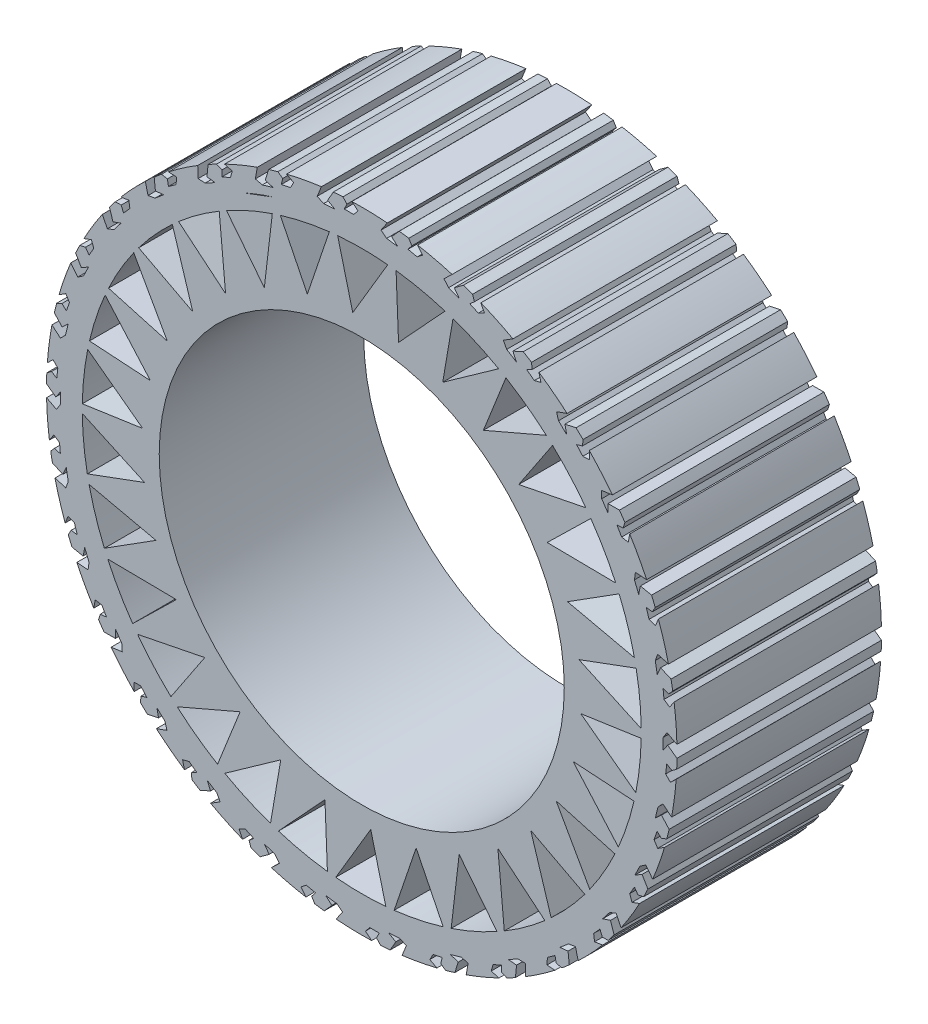
from build123d import *

# Parameters (mm, degrees)
SKETCH1_R           = 203
BOSS_EXTRUDE5_DEPTH = 205


with BuildPart() as part:
    # Sketch1 → Boss-Extrude5 (new body)
    with BuildSketch(Plane.XY):
        with BuildLine():
            Line((151.513191313, 266.644594898), (154.948122137, 259.055511918))
            Line((154.948122137, 259.055511918), (145.289916223, 265.060588741))
            Line((145.289916223, 265.060588741), (141.948192606, 271.35840521))
            Line((141.948192606, 271.35840521), (151.513191313, 277.308046868))
            ThreePointArc((151.513191313, 277.308046868), (135.683063434, 285.387642159), (119.423731597, 292.564475512))
            Line((119.423731597, 292.564475512), (122.970226981, 285.356586014))
            Line((122.970226981, 285.356586014), (116.850937177, 282.345713961))
            Line((116.850937177, 282.345713961), (108.289531928, 286.226520606))
            Line((108.289531928, 286.226520606), (112.97508405, 290.235634194))
            Line((112.97508405, 290.235634194), (111.08599614, 295.83086631))
            ThreePointArc((111.08599614, 295.83086631), (106.540858754, 297.497975482), (101.970714815, 299.095257936))
            Line((101.970714815, 299.095257936), (92.76373599, 292.319134535))
            Line((92.76373599, 292.319134535), (97.701464408, 285.610053502))
            Line((97.701464408, 285.610053502), (87.00578779, 289.475851067))
            Line((87.00578779, 289.475851067), (82.427699181, 294.941261729))
            Line((82.427699181, 294.941261729), (90.546679661, 302.749564496))
            ThreePointArc((90.546679661, 302.749564496), (73.382635738, 307.361332591), (55.986461755, 311.000829742))
            Line((55.986461755, 311.000829742), (60.954062199, 304.687807775))
            Line((60.954062199, 304.687807775), (55.594489058, 300.470458611))
            Line((55.594489058, 300.470458611), (46.413305984, 302.486444078))
            Line((46.413305984, 302.486444078), (50.162925965, 307.38212998))
            Line((50.162925965, 307.38212998), (47.151804989, 312.462329387))
            ThreePointArc((47.151804989, 312.462329387), (42.359378273, 313.148021026), (37.557009249, 313.760212672))
            Line((37.557009249, 313.760212672), (29.960060274, 305.21792529))
            Line((29.960060274, 305.21792529), (36.184783861, 299.682065239))
            Line((36.184783861, 299.682065239), (24.919088931, 301.239629642))
            Line((24.919088931, 301.239629642), (19.30471977, 305.633769824))
            Line((19.30471977, 305.633769824), (25.622843616, 314.959473401))
            ThreePointArc((25.622843616, 314.959473401), (7.875034732, 315.901857905), (-9.897685118, 315.844955365))
            Line((-9.897685118, 315.844955365), (-3.726087591, 310.702710282))
            Line((-3.726087591, 310.702710282), (-8.091705004, 305.463202402))
            Line((-8.091705004, 305.463202402), (-17.491404147, 305.526258453))
            Line((-17.491404147, 305.526258453), (-14.841592692, 311.094551702))
            Line((-14.841592692, 311.094551702), (-18.843146299, 315.43768931))
            ThreePointArc((-18.843146299, 315.43768931), (-23.673410302, 315.1119954), (-28.498117841, 314.712340526))
            Line((-28.498117841, 314.712340526), (-34.15301384, 304.777228112))
            Line((-34.15301384, 304.777228112), (-26.913345375, 300.656532691))
            Line((-26.913345375, 300.656532691), (-38.25669369, 299.837790893))
            Line((-38.25669369, 299.837790893), (-44.661968529, 302.968615585))
            Line((-44.661968529, 302.968615585), (-40.420833647, 313.404141975))
            ThreePointArc((-40.420833647, 313.404141975), (-57.976743081, 310.635956164), (-75.349255657, 306.885140846))
            Line((-75.349255657, 306.885140846), (-68.243389474, 303.138413433))
            Line((-68.243389474, 303.138413433), (-71.42425273, 297.105738473))
            Line((-71.42425273, 297.105738473), (-80.631655984, 295.213109256))
            Line((-80.631655984, 295.213109256), (-79.197462532, 301.210648717))
            Line((-79.197462532, 301.210648717), (-84.014561675, 304.626908573))
            ThreePointArc((-84.014561675, 304.626908573), (-88.671557248, 303.304063499), (-93.307740431, 301.910028942))
            Line((-93.307740431, 301.910028942), (-96.773437365, 291.016303582))
            Line((-96.773437365, 291.016303582), (-88.835232273, 288.490866954))
            Line((-88.835232273, 288.490866954), (-99.760475221, 285.331601901))
            Line((-99.760475221, 285.331601901), (-106.676714492, 287.06227904))
            Line((-106.676714492, 287.06227904), (-104.697926519, 298.151545665))
            ThreePointArc((-104.697926519, 298.151545665), (-121.294659018, 291.793772541), (-137.507702158, 284.512973074))
            Line((-137.507702158, 284.512973074), (-129.778127768, 282.325513297))
            Line((-129.778127768, 282.325513297), (-131.635217879, 275.763328101))
            Line((-131.635217879, 275.763328101), (-140.247917541, 271.997730595))
            Line((-140.247917541, 271.997730595), (-140.092023227, 278.162395015))
            Line((-140.092023227, 278.162395015), (-145.514137559, 280.502470168))
            ThreePointArc((-145.514137559, 280.502470168), (-149.79433165, 278.24028861), (-154.039367025, 275.912800367))
            Line((-154.039367025, 275.912800367), (-155.164397307, 264.536570135))
            Line((-155.164397307, 264.536570135), (-146.874593243, 263.716765998))
            Line((-146.874593243, 263.716765998), (-156.90424528, 258.355052733))
            Line((-156.90424528, 258.355052733), (-164.029176139, 258.609943423))
            Line((-164.029176139, 258.609943423), (-164.399217605, 269.86829612))
            ThreePointArc((-164.399217605, 269.86829612), (-179.311416319, 260.198800877), (-193.65640224, 249.706223133))
            Line((-193.65640224, 249.706223133), (-185.640939135, 249.173633482))
            Line((-185.640939135, 249.173633482), (-186.093092352, 242.368737032))
            Line((-186.093092352, 242.368737032), (-193.734672118, 236.894745917))
            Line((-193.734672118, 236.894745917), (-194.863890271, 242.957109879))
            Line((-194.863890271, 242.957109879), (-200.654047378, 244.118727817))
            ThreePointArc((-200.654047378, 244.118727817), (-204.370374965, 241.016077963), (-208.038734117, 237.85685844))
            Line((-208.038734117, 237.85685844), (-206.773928525, 226.495319185))
            Line((-206.773928525, 226.495319185), (-198.494829705, 227.416976915))
            Line((-198.494829705, 227.416976915), (-207.190546911, 220.087148036))
            Line((-207.190546911, 220.087148036), (-214.21277569, 218.855112331))
            Line((-214.21277569, 218.855112331), (-216.915474008, 229.790507063))
            ThreePointArc((-216.915474008, 229.790507063), (-229.491404296, 217.231893041), (-241.341388277, 203.986113019))
            Line((-241.341388277, 203.986113019), (-233.390350657, 205.131670216))
            Line((-233.390350657, 205.131670216), (-232.417805715, 198.38146914))
            Line((-232.417805715, 198.38146914), (-238.75429188, 191.438324095))
            Line((-238.75429188, 191.438324095), (-241.119270249, 197.133433204))
            Line((-241.119270249, 197.133433204), (-247.024412481, 197.065825649))
            ThreePointArc((-247.024412481, 197.065825649), (-250.014452217, 193.258308186), (-252.945810247, 189.405430436))
            Line((-252.945810247, 189.405430436), (-249.346446855, 178.555135942))
            Line((-249.346446855, 178.555135942), (-241.439889625, 181.177974673))
            Line((-241.439889625, 181.177974673), (-248.421627431, 172.200378874))
            Line((-248.421627431, 172.200378874), (-255.034249037, 169.535262646))
            Line((-255.034249037, 169.535262646), (-259.95148332, 179.669770189))
            ThreePointArc((-259.95148332, 179.669770189), (-269.641516683, 164.770909086), (-278.478597562, 149.350830932))
            Line((-278.478597562, 149.350830932), (-270.939483925, 152.124468631))
            Line((-270.939483925, 152.124468631), (-268.584745703, 145.723979107))
            Line((-268.584745703, 145.723979107), (-273.339203417, 137.615128887))
            Line((-273.339203417, 137.615128887), (-276.836581099, 142.694079547))
            Line((-276.836581099, 142.694079547), (-282.598625404, 141.400201273))
            ThreePointArc((-282.598625404, 141.400201273), (-284.731698204, 137.054222984), (-286.797940701, 132.676076253))
            Line((-286.797940701, 132.676076253), (-281.02132896, 122.811236455))
            Line((-281.02132896, 122.811236455), (-273.832867811, 127.02062555))
            Line((-273.832867811, 127.02062555), (-278.795490773, 116.787626846))
            Line((-278.795490773, 116.787626846), (-284.70950191, 112.805908463))
            Line((-284.70950191, 112.805908463), (-291.626365425, 121.696602207))
            ThreePointArc((-291.626365425, 121.696602207), (-298.007000907, 105.108645745), (-303.444955845, 88.188200868))
            Line((-303.444955845, 88.188200868), (-296.647261633, 92.468697792))
            Line((-296.647261633, 92.468697792), (-293.013243492, 86.697651926))
            Line((-293.013243492, 86.697651926), (-295.977880138, 77.777492196))
            Line((-295.977880138, 77.777492196), (-300.454804946, 82.018309891))
            Line((-300.454804946, 82.018309891), (-305.821922338, 79.554709588))
            ThreePointArc((-305.821922338, 79.554709588), (-307.004802686, 74.86021058), (-308.115624937, 70.148140888))
            Line((-308.115624937, 70.148140888), (-300.4142305, 61.699896622))
            Line((-300.4142305, 61.699896622), (-294.258035679, 67.311865577))
            Line((-294.258035679, 67.311865577), (-296.984653359, 56.270695116))
            Line((-296.984653359, 56.270695116), (-301.941583363, 51.146394778))
            Line((-301.941583363, 51.146394778), (-310.555775983, 58.404708744))
            ThreePointArc((-310.555775983, 58.404708744), (-313.348149196, 40.852630218), (-315.149313467, 23.171323252))
            Line((-315.149313467, 23.171323252), (-309.390130536, 28.771601146))
            Line((-309.390130536, 28.771601146), (-304.635656507, 23.882221334))
            Line((-304.635656507, 23.882221334), (-305.680903238, 14.540605879))
            Line((-305.680903238, 14.540605879), (-310.941712074, 17.757946526))
            Line((-310.941712074, 17.757946526), (-315.679333769, 14.232295348))
            ThreePointArc((-315.679333769, 14.232295348), (-315.860324117, 9.394447753), (-315.96717786, 4.554395157))
            Line((-315.96717786, 4.554395157), (-306.67758862, -2.108024763))
            Line((-306.67758862, -2.108024763), (-301.82271538, 4.661254081))
            Line((-301.82271538, 4.661254081), (-302.194161503, -6.705536008))
            Line((-302.194161503, -6.705536008), (-305.977368745, -12.748461787))
            Line((-305.977368745, -12.748461787), (-315.912408919, -7.439750748))
            ThreePointArc((-315.912408919, -7.439750748), (-314.994479753, -25.188841283), (-313.080133836, -42.858252378))
            Line((-313.080133836, -42.858252378), (-308.611166116, -36.182952532))
            Line((-308.611166116, -36.182952532), (-302.944029529, -39.97697693))
            Line((-302.944029529, -39.97697693), (-302.024204046, -49.331774689))
            Line((-302.024204046, -49.331774689), (-307.838974321, -47.278524315))
            Line((-307.838974321, -47.278524315), (-311.740043518, -51.712138493))
            ThreePointArc((-311.740043518, -51.712138493), (-310.911233719, -56.481897519), (-310.009448932, -61.238399496))
            Line((-310.009448932, -61.238399496), (-299.537664515, -65.82381535))
            Line((-299.537664515, -65.82381535), (-296.196294113, -58.193076587))
            Line((-296.196294113, -58.193076587), (-294.196334701, -69.388703031))
            Line((-294.196334701, -69.388703031), (-296.640474872, -76.086149398))
            Line((-296.640474872, -76.086149398), (-307.462153668, -72.959057433))
            ThreePointArc((-307.462153668, -72.959057433), (-302.874040034, -90.12943955), (-297.327850032, -107.014716723))
            Line((-297.327850032, -107.014716723), (-294.344412857, -99.556137559))
            Line((-294.344412857, -99.556137559), (-288.012294773, -102.088989471))
            Line((-288.012294773, -102.088989471), (-285.167597864, -111.048119983))
            Line((-285.167597864, -111.048119983), (-291.282196214, -110.248696776))
            Line((-291.282196214, -110.248696776), (-294.17621747, -115.396503739))
            ThreePointArc((-294.17621747, -115.396503739), (-292.37383049, -119.88971284), (-290.502819496, -124.354782237))
            Line((-290.502819496, -124.354782237), (-279.306507129, -126.662789349))
            Line((-279.306507129, -126.662789349), (-277.624673486, -118.504090565))
            Line((-277.624673486, -118.504090565), (-273.340716362, -129.039250768))
            Line((-273.340716362, -129.039250768), (-274.338968807, -136.098507178))
            Line((-274.338968807, -136.098507178), (-285.574326936, -135.289703212))
            ThreePointArc((-285.574326936, -135.289703212), (-277.516551414, -151.130948819), (-268.580912444, -166.494124433))
            Line((-268.580912444, -166.494124433), (-267.213396334, -158.578241652))
            Line((-267.213396334, -158.578241652), (-260.493040699, -159.739223295))
            Line((-260.493040699, -159.739223295), (-255.84779927, -167.911129566))
            Line((-255.84779927, -167.911129566), (-261.994988407, -168.400472155))
            Line((-261.994988407, -168.400472155), (-263.755479104, -174.037488038))
            ThreePointArc((-263.755479104, -174.037488038), (-261.058287902, -178.057772415), (-258.29982286, -182.036264273))
            Line((-258.29982286, -182.036264273), (-246.86831512, -181.965991657))
            Line((-246.86831512, -181.965991657), (-246.919522436, -173.635907141))
            Line((-246.919522436, -173.635907141), (-240.538797083, -183.050164047))
            Line((-240.538797083, -183.050164047), (-240.047533381, -190.162707122))
            Line((-240.047533381, -190.162707122), (-251.205531779, -191.707539768))
            ThreePointArc((-251.205531779, -191.707539768), (-240.030257826, -205.527310419), (-228.095700188, -218.696939978))
            Line((-228.095700188, -218.696939978), (-228.403872159, -210.669715641))
            Line((-228.403872159, -210.669715641), (-221.588990762, -210.408086547))
            Line((-221.588990762, -210.408086547), (-215.346224154, -217.43561706))
            Line((-215.346224154, -217.43561706), (-221.257342414, -219.192338826))
            Line((-221.257342414, -219.192338826), (-221.807360663, -225.072198985))
            ThreePointArc((-221.807360663, -225.072198985), (-218.333245437, -228.44385292), (-214.807884505, -231.761888054))
            Line((-214.807884505, -231.761888054), (-203.640793135, -229.316406961))
            Line((-203.640793135, -229.316406961), (-205.422803405, -221.179001377))
            Line((-205.422803405, -221.179001377), (-197.224178139, -229.060906785))
            Line((-197.224178139, -229.060906785), (-195.264868871, -235.915884262))
            Line((-195.264868871, -235.915884262), (-205.857849465, -239.746836921))
            ThreePointArc((-205.857849465, -239.746836921), (-192.053490178, -250.941142323), (-177.641611309, -261.341649822))
            Line((-177.641611309, -261.341649822), (-179.612002768, -253.553912152))
            Line((-179.612002768, -253.553912152), (-173.000438628, -251.881106767))
            Line((-173.000438628, -251.881106767), (-165.432985696, -257.457124716))
            Line((-165.432985696, -257.457124716), (-170.849688847, -260.404448489))
            Line((-170.849688847, -260.404448489), (-170.16519621, -266.27017482))
            ThreePointArc((-170.16519621, -266.27017482), (-166.065992468, -268.845840856), (-161.927810835, -271.35840521))
            Line((-161.927810835, -271.35840521), (-151.513191313, -266.644594898))
            Line((-151.513191313, -266.644594898), (-154.948122137, -259.055511918))
            Line((-154.948122137, -259.055511918), (-145.289916223, -265.060588741))
            Line((-145.289916223, -265.060588741), (-141.948192606, -271.35840521))
            Line((-141.948192606, -271.35840521), (-151.513191313, -277.308046868))
            ThreePointArc((-151.513191313, -277.308046868), (-135.683063434, -285.387642159), (-119.423731597, -292.564475512))
            Line((-119.423731597, -292.564475512), (-122.970226981, -285.356586014))
            Line((-122.970226981, -285.356586014), (-116.850937177, -282.345713961))
            Line((-116.850937177, -282.345713961), (-108.289531928, -286.226520606))
            Line((-108.289531928, -286.226520606), (-112.97508405, -290.235634194))
            Line((-112.97508405, -290.235634194), (-111.08599614, -295.83086631))
            ThreePointArc((-111.08599614, -295.83086631), (-106.540858754, -297.497975482), (-101.970714815, -299.095257936))
            Line((-101.970714815, -299.095257936), (-92.76373599, -292.319134535))
            Line((-92.76373599, -292.319134535), (-97.701464408, -285.610053502))
            Line((-97.701464408, -285.610053502), (-87.00578779, -289.475851067))
            Line((-87.00578779, -289.475851067), (-82.427699181, -294.941261729))
            Line((-82.427699181, -294.941261729), (-90.546679661, -302.749564496))
            ThreePointArc((-90.546679661, -302.749564496), (-73.382635738, -307.361332591), (-55.986461755, -311.000829742))
            Line((-55.986461755, -311.000829742), (-60.954062199, -304.687807775))
            Line((-60.954062199, -304.687807775), (-55.594489058, -300.470458611))
            Line((-55.594489058, -300.470458611), (-46.413305984, -302.486444078))
            Line((-46.413305984, -302.486444078), (-50.162925965, -307.38212998))
            Line((-50.162925965, -307.38212998), (-47.151804989, -312.462329387))
            ThreePointArc((-47.151804989, -312.462329387), (-42.359378273, -313.148021026), (-37.557009249, -313.760212672))
            Line((-37.557009249, -313.760212672), (-29.960060274, -305.21792529))
            Line((-29.960060274, -305.21792529), (-36.184783861, -299.682065239))
            Line((-36.184783861, -299.682065239), (-24.919088931, -301.239629642))
            Line((-24.919088931, -301.239629642), (-19.30471977, -305.633769824))
            Line((-19.30471977, -305.633769824), (-25.622843616, -314.959473401))
            ThreePointArc((-25.622843616, -314.959473401), (-7.875034732, -315.901857905), (9.897685118, -315.844955365))
            Line((9.897685118, -315.844955365), (3.726087591, -310.702710282))
            Line((3.726087591, -310.702710282), (8.091705004, -305.463202402))
            Line((8.091705004, -305.463202402), (17.491404147, -305.526258453))
            Line((17.491404147, -305.526258453), (14.841592692, -311.094551702))
            Line((14.841592692, -311.094551702), (18.843146299, -315.43768931))
            ThreePointArc((18.843146299, -315.43768931), (23.673410302, -315.1119954), (28.498117841, -314.712340526))
            Line((28.498117841, -314.712340526), (34.15301384, -304.777228112))
            Line((34.15301384, -304.777228112), (26.913345375, -300.656532691))
            Line((26.913345375, -300.656532691), (38.25669369, -299.837790893))
            Line((38.25669369, -299.837790893), (44.661968529, -302.968615585))
            Line((44.661968529, -302.968615585), (40.420833647, -313.404141975))
            ThreePointArc((40.420833647, -313.404141975), (57.976743081, -310.635956164), (75.349255657, -306.885140846))
            Line((75.349255657, -306.885140846), (68.243389474, -303.138413433))
            Line((68.243389474, -303.138413433), (71.42425273, -297.105738473))
            Line((71.42425273, -297.105738473), (80.631655984, -295.213109256))
            Line((80.631655984, -295.213109256), (79.197462532, -301.210648717))
            Line((79.197462532, -301.210648717), (84.014561675, -304.626908573))
            ThreePointArc((84.014561675, -304.626908573), (88.671557248, -303.304063499), (93.307740431, -301.910028942))
            Line((93.307740431, -301.910028942), (96.773437365, -291.016303582))
            Line((96.773437365, -291.016303582), (88.835232273, -288.490866954))
            Line((88.835232273, -288.490866954), (99.760475221, -285.331601901))
            Line((99.760475221, -285.331601901), (106.676714492, -287.06227904))
            Line((106.676714492, -287.06227904), (104.697926519, -298.151545665))
            ThreePointArc((104.697926519, -298.151545665), (121.294659018, -291.793772541), (137.507702158, -284.512973074))
            Line((137.507702158, -284.512973074), (129.778127768, -282.325513297))
            Line((129.778127768, -282.325513297), (131.635217879, -275.763328101))
            Line((131.635217879, -275.763328101), (140.247917541, -271.997730595))
            Line((140.247917541, -271.997730595), (140.092023227, -278.162395015))
            Line((140.092023227, -278.162395015), (145.514137559, -280.502470168))
            ThreePointArc((145.514137559, -280.502470168), (149.79433165, -278.24028861), (154.039367025, -275.912800367))
            Line((154.039367025, -275.912800367), (155.164397307, -264.536570135))
            Line((155.164397307, -264.536570135), (146.874593243, -263.716765998))
            Line((146.874593243, -263.716765998), (156.90424528, -258.355052733))
            Line((156.90424528, -258.355052733), (164.029176139, -258.609943423))
            Line((164.029176139, -258.609943423), (164.399217605, -269.86829612))
            ThreePointArc((164.399217605, -269.86829612), (179.311416319, -260.198800877), (193.65640224, -249.706223133))
            Line((193.65640224, -249.706223133), (185.640939135, -249.173633482))
            Line((185.640939135, -249.173633482), (186.093092352, -242.368737032))
            Line((186.093092352, -242.368737032), (193.734672118, -236.894745917))
            Line((193.734672118, -236.894745917), (194.863890271, -242.957109879))
            Line((194.863890271, -242.957109879), (200.654047378, -244.118727817))
            ThreePointArc((200.654047378, -244.118727817), (204.370374965, -241.016077963), (208.038734117, -237.85685844))
            Line((208.038734117, -237.85685844), (206.773928525, -226.495319185))
            Line((206.773928525, -226.495319185), (198.494829705, -227.416976915))
            Line((198.494829705, -227.416976915), (207.190546911, -220.087148036))
            Line((207.190546911, -220.087148036), (214.21277569, -218.855112331))
            Line((214.21277569, -218.855112331), (216.915474008, -229.790507063))
            ThreePointArc((216.915474008, -229.790507063), (229.491404296, -217.231893041), (241.341388277, -203.986113019))
            Line((241.341388277, -203.986113019), (233.390350657, -205.131670216))
            Line((233.390350657, -205.131670216), (232.417805715, -198.38146914))
            Line((232.417805715, -198.38146914), (238.75429188, -191.438324095))
            Line((238.75429188, -191.438324095), (241.119270249, -197.133433204))
            Line((241.119270249, -197.133433204), (247.024412481, -197.065825649))
            ThreePointArc((247.024412481, -197.065825649), (250.014452217, -193.258308186), (252.945810247, -189.405430436))
            Line((252.945810247, -189.405430436), (249.346446855, -178.555135942))
            Line((249.346446855, -178.555135942), (241.439889625, -181.177974673))
            Line((241.439889625, -181.177974673), (248.421627431, -172.200378874))
            Line((248.421627431, -172.200378874), (255.034249037, -169.535262646))
            Line((255.034249037, -169.535262646), (259.95148332, -179.669770189))
            ThreePointArc((259.95148332, -179.669770189), (269.641516683, -164.770909086), (278.478597562, -149.350830932))
            Line((278.478597562, -149.350830932), (270.939483925, -152.124468631))
            Line((270.939483925, -152.124468631), (268.584745703, -145.723979107))
            Line((268.584745703, -145.723979107), (273.339203417, -137.615128887))
            Line((273.339203417, -137.615128887), (276.836581099, -142.694079547))
            Line((276.836581099, -142.694079547), (282.598625404, -141.400201273))
            ThreePointArc((282.598625404, -141.400201273), (284.731698204, -137.054222984), (286.797940701, -132.676076253))
            Line((286.797940701, -132.676076253), (281.02132896, -122.811236455))
            Line((281.02132896, -122.811236455), (273.832867811, -127.02062555))
            Line((273.832867811, -127.02062555), (278.795490773, -116.787626846))
            Line((278.795490773, -116.787626846), (284.70950191, -112.805908463))
            Line((284.70950191, -112.805908463), (291.626365425, -121.696602207))
            ThreePointArc((291.626365425, -121.696602207), (298.007000907, -105.108645745), (303.444955845, -88.188200868))
            Line((303.444955845, -88.188200868), (296.647261633, -92.468697792))
            Line((296.647261633, -92.468697792), (293.013243492, -86.697651926))
            Line((293.013243492, -86.697651926), (295.977880138, -77.777492196))
            Line((295.977880138, -77.777492196), (300.454804946, -82.018309891))
            Line((300.454804946, -82.018309891), (305.821922338, -79.554709588))
            ThreePointArc((305.821922338, -79.554709588), (307.004802686, -74.86021058), (308.115624937, -70.148140888))
            Line((308.115624937, -70.148140888), (300.4142305, -61.699896622))
            Line((300.4142305, -61.699896622), (294.258035679, -67.311865577))
            Line((294.258035679, -67.311865577), (296.984653359, -56.270695116))
            Line((296.984653359, -56.270695116), (301.941583363, -51.146394778))
            Line((301.941583363, -51.146394778), (310.555775983, -58.404708744))
            ThreePointArc((310.555775983, -58.404708744), (313.348149196, -40.852630218), (315.149313467, -23.171323252))
            Line((315.149313467, -23.171323252), (309.390130536, -28.771601146))
            Line((309.390130536, -28.771601146), (304.635656507, -23.882221334))
            Line((304.635656507, -23.882221334), (305.680903238, -14.540605879))
            Line((305.680903238, -14.540605879), (310.941712074, -17.757946526))
            Line((310.941712074, -17.757946526), (315.679333769, -14.232295348))
            ThreePointArc((315.679333769, -14.232295348), (315.860324117, -9.394447753), (315.96717786, -4.554395157))
            Line((315.96717786, -4.554395157), (306.67758862, 2.108024763))
            Line((306.67758862, 2.108024763), (301.82271538, -4.661254081))
            Line((301.82271538, -4.661254081), (302.194161503, 6.705536008))
            Line((302.194161503, 6.705536008), (305.977368745, 12.748461787))
            Line((305.977368745, 12.748461787), (315.912408919, 7.439750748))
            ThreePointArc((315.912408919, 7.439750748), (314.994479753, 25.188841283), (313.080133836, 42.858252378))
            Line((313.080133836, 42.858252378), (308.611166116, 36.182952532))
            Line((308.611166116, 36.182952532), (302.944029529, 39.97697693))
            Line((302.944029529, 39.97697693), (302.024204046, 49.331774689))
            Line((302.024204046, 49.331774689), (307.838974321, 47.278524315))
            Line((307.838974321, 47.278524315), (311.740043518, 51.712138493))
            ThreePointArc((311.740043518, 51.712138493), (310.911233719, 56.481897519), (310.009448932, 61.238399496))
            Line((310.009448932, 61.238399496), (299.537664515, 65.82381535))
            Line((299.537664515, 65.82381535), (296.196294113, 58.193076587))
            Line((296.196294113, 58.193076587), (294.196334701, 69.388703031))
            Line((294.196334701, 69.388703031), (296.640474872, 76.086149398))
            Line((296.640474872, 76.086149398), (307.462153668, 72.959057433))
            ThreePointArc((307.462153668, 72.959057433), (302.874040034, 90.12943955), (297.327850032, 107.014716723))
            Line((297.327850032, 107.014716723), (294.344412857, 99.556137559))
            Line((294.344412857, 99.556137559), (288.012294773, 102.088989471))
            Line((288.012294773, 102.088989471), (285.167597864, 111.048119983))
            Line((285.167597864, 111.048119983), (291.282196214, 110.248696776))
            Line((291.282196214, 110.248696776), (294.17621747, 115.396503739))
            ThreePointArc((294.17621747, 115.396503739), (292.37383049, 119.88971284), (290.502819496, 124.354782237))
            Line((290.502819496, 124.354782237), (279.306507129, 126.662789349))
            Line((279.306507129, 126.662789349), (277.624673486, 118.504090565))
            Line((277.624673486, 118.504090565), (273.340716362, 129.039250768))
            Line((273.340716362, 129.039250768), (274.338968807, 136.098507178))
            Line((274.338968807, 136.098507178), (285.574326936, 135.289703212))
            ThreePointArc((285.574326936, 135.289703212), (277.516551414, 151.130948819), (268.580912444, 166.494124433))
            Line((268.580912444, 166.494124433), (267.213396334, 158.578241652))
            Line((267.213396334, 158.578241652), (260.493040699, 159.739223295))
            Line((260.493040699, 159.739223295), (255.84779927, 167.911129566))
            Line((255.84779927, 167.911129566), (261.994988407, 168.400472155))
            Line((261.994988407, 168.400472155), (263.755479104, 174.037488038))
            ThreePointArc((263.755479104, 174.037488038), (261.058287902, 178.057772415), (258.29982286, 182.036264273))
            Line((258.29982286, 182.036264273), (246.86831512, 181.965991657))
            Line((246.86831512, 181.965991657), (246.919522436, 173.635907141))
            Line((246.919522436, 173.635907141), (240.538797083, 183.050164047))
            Line((240.538797083, 183.050164047), (240.047533381, 190.162707122))
            Line((240.047533381, 190.162707122), (251.205531779, 191.707539768))
            ThreePointArc((251.205531779, 191.707539768), (240.030257826, 205.527310419), (228.095700188, 218.696939978))
            Line((228.095700188, 218.696939978), (228.403872159, 210.669715641))
            Line((228.403872159, 210.669715641), (221.588990762, 210.408086547))
            Line((221.588990762, 210.408086547), (215.346224154, 217.43561706))
            Line((215.346224154, 217.43561706), (221.257342414, 219.192338826))
            Line((221.257342414, 219.192338826), (221.807360663, 225.072198985))
            ThreePointArc((221.807360663, 225.072198985), (218.333245437, 228.44385292), (214.807884505, 231.761888054))
            Line((214.807884505, 231.761888054), (203.640793135, 229.316406961))
            Line((203.640793135, 229.316406961), (205.422803405, 221.179001377))
            Line((205.422803405, 221.179001377), (197.224178139, 229.060906785))
            Line((197.224178139, 229.060906785), (195.264868871, 235.915884262))
            Line((195.264868871, 235.915884262), (205.857849465, 239.746836921))
            ThreePointArc((205.857849465, 239.746836921), (192.053490178, 250.941142323), (177.641611309, 261.341649822))
            Line((177.641611309, 261.341649822), (179.612002768, 253.553912152))
            Line((179.612002768, 253.553912152), (173.000438628, 251.881106767))
            Line((173.000438628, 251.881106767), (165.432985696, 257.457124716))
            Line((165.432985696, 257.457124716), (170.849688847, 260.404448489))
            Line((170.849688847, 260.404448489), (170.16519621, 266.27017482))
            ThreePointArc((170.16519621, 266.27017482), (166.065992468, 268.845840856), (161.927810835, 271.35840521))
            Line((161.927810835, 271.35840521), (151.513191313, 266.644594898))
        make_face()
        with BuildLine():
            ThreePointArc((-118.06690528, 269.251194756), (-103.121571845, 275.321523714), (-87.865795324, 280.563008987))
            Line((-87.865795324, 280.563008987), (-118.06690528, 269.251194756))
        make_face(mode=Mode.SUBTRACT)
        with BuildLine():
            ThreePointArc((-223.57318077, 168.816733448), (-207.545118057, 188.173007157), (-189.846932051, 206.015045671))
            Line((-189.846932051, 206.015045671), (-169.384998998, 140.387756284))
            Line((-169.384998998, 140.387756284), (-223.57318077, 168.816733448))
        make_face(mode=Mode.SUBTRACT)
        with BuildLine():
            ThreePointArc((-253.786542848, 118.644204751), (-242.133127356, 140.909919057), (-228.531257571, 162.041725999))
            Line((-228.531257571, 162.041725999), (-194.871786149, 102.102825441))
            Line((-194.871786149, 102.102825441), (-253.786542848, 118.644204751))
        make_face(mode=Mode.SUBTRACT)
        with BuildLine():
            ThreePointArc((-272.908215201, 63.286354988), (-266.138757105, 87.488391334), (-257.227670522, 110.986405338))
            Line((-257.227670522, 110.986405338), (-211.841741147, 59.355511182))
            Line((-211.841741147, 59.355511182), (-272.908215201, 63.286354988))
        make_face(mode=Mode.SUBTRACT)
        with BuildLine():
            ThreePointArc((-280.102488991, 5.16258783), (-278.512846094, 30.243201094), (-274.681999955, 55.080446192))
            Line((-274.681999955, 55.080446192), (-219.553195528, 14.014076265))
            Line((-219.553195528, 14.014076265), (-280.102488991, 5.16258783))
        make_face(mode=Mode.SUBTRACT)
        with BuildLine():
            ThreePointArc((-275.05493993, -53.186809189), (-278.714587256, -28.323762158), (-280.131407919, -3.232792758))
            Line((-280.131407919, -3.232792758), (-217.66912173, -31.939841031))
            Line((-217.66912173, -31.939841031), (-275.05493993, -53.186809189))
        make_face(mode=Mode.SUBTRACT)
        with BuildLine():
            ThreePointArc((-257.986170135, -109.211687428), (-266.735163533, -85.65284109), (-273.337729138, -61.404743151))
            Line((-273.337729138, -61.404743151), (-206.271862821, -76.49783401))
            Line((-206.271862821, -76.49783401), (-257.986170135, -109.211687428))
        make_face(mode=Mode.SUBTRACT)
        with BuildLine():
            ThreePointArc((-229.64216675, -160.46349087), (-243.098133227, -139.238479859), (-254.597879974, -116.893011616))
            Line((-254.597879974, -116.893011616), (-185.859533705, -117.712504566))
            Line((-185.859533705, -117.712504566), (-229.64216675, -160.46349087))
        make_face(mode=Mode.SUBTRACT)
        with BuildLine():
            ThreePointArc((-191.261698733, -204.702269772), (-208.836547984, -186.738728918), (-224.730881758, -167.272494559))
            Line((-224.730881758, -167.272494559), (-157.324251112, -153.782573824))
            Line((-157.324251112, -153.782573824), (-191.261698733, -204.702269772))
        make_face(mode=Mode.SUBTRACT)
        with BuildLine():
            ThreePointArc((-144.522176705, -239.994577214), (-165.447803486, -226.077599451), (-185.042065631, -210.341366827))
            Line((-185.042065631, -210.341366827), (-121.91314382, -183.131606676))
            Line((-121.91314382, -183.131606676), (-144.522176705, -239.994577214))
        make_face(mode=Mode.SUBTRACT)
        with BuildLine():
            ThreePointArc((-91.466342061, -264.797970011), (-114.828196068, -255.535794047), (-137.266023306, -244.217312035))
            Line((-137.266023306, -244.217312035), (-81.17384714, -204.476909554))
            Line((-81.17384714, -204.476909554), (-91.466342061, -264.797970011))
        make_face(mode=Mode.SUBTRACT)
        with BuildLine():
            ThreePointArc((-34.412989365, -278.028420876), (-59.190045476, -273.825848247), (-83.490797087, -267.419788822))
            Line((-83.490797087, -267.419788822), (-36.886863823, -216.885590294))
            Line((-36.886863823, -216.885590294), (-34.412989365, -278.028420876))
        make_face(mode=Mode.SUBTRACT)
        with BuildLine():
            ThreePointArc((24.144376098, -279.107695621), (-0.965005871, -280.148398916), (-26.066622402, -278.934737615))
            Line((-26.066622402, -278.934737615), (9.012252445, -219.815330007))
            Line((9.012252445, -219.815330007), (24.144376098, -279.107695621))
        make_face(mode=Mode.SUBTRACT)
        with BuildLine():
            ThreePointArc((81.646516468, -267.988624759), (57.302209121, -274.227120252), (32.496788763, -278.258899897))
            Line((32.496788763, -278.258899897), (54.517490035, -213.138085007))
            Line((54.517490035, -213.138085007), (81.646516468, -267.988624759))
        make_face(mode=Mode.SUBTRACT)
        with BuildLine():
            ThreePointArc((135.580312285, -245.157165044), (113.065042608, -256.320800545), (89.639934323, -265.421813019))
            Line((89.639934323, -265.421813019), (97.640051707, -197.145682942))
            Line((97.640051707, -197.145682942), (135.580312285, -245.157165044))
        make_face(mode=Mode.SUBTRACT)
        with BuildLine():
            ThreePointArc((183.588597869, -211.611160822), (163.886391187, -227.21203189), (142.865384613, -240.984519277))
            Line((142.865384613, -240.984519277), (136.495274591, -172.537068523))
            Line((136.495274591, -172.537068523), (183.588597869, -211.611160822))
        make_face(mode=Mode.SUBTRACT)
        with BuildLine():
            ThreePointArc((223.57318077, -168.816733448), (207.545118057, -188.173007157), (189.846932051, -206.015045671))
            Line((189.846932051, -206.015045671), (169.384998998, -140.387756284))
            Line((169.384998998, -140.387756284), (223.57318077, -168.816733448))
        make_face(mode=Mode.SUBTRACT)
        with BuildLine():
            ThreePointArc((253.786542848, -118.644204751), (242.133127356, -140.909919057), (228.531257571, -162.041725999))
            Line((228.531257571, -162.041725999), (194.871786149, -102.102825441))
            Line((194.871786149, -102.102825441), (253.786542848, -118.644204751))
        make_face(mode=Mode.SUBTRACT)
        with BuildLine():
            ThreePointArc((272.908215201, -63.286354988), (266.138757105, -87.488391334), (257.227670522, -110.986405338))
            Line((257.227670522, -110.986405338), (211.841741147, -59.355511182))
            Line((211.841741147, -59.355511182), (272.908215201, -63.286354988))
        make_face(mode=Mode.SUBTRACT)
        with BuildLine():
            ThreePointArc((280.102488991, -5.16258783), (278.512846094, -30.243201094), (274.681999955, -55.080446192))
            Line((274.681999955, -55.080446192), (219.553195528, -14.014076265))
            Line((219.553195528, -14.014076265), (280.102488991, -5.16258783))
        make_face(mode=Mode.SUBTRACT)
        with BuildLine():
            ThreePointArc((275.05493993, 53.186809189), (278.714587256, 28.323762158), (280.131407919, 3.232792758))
            Line((280.131407919, 3.232792758), (217.66912173, 31.939841031))
            Line((217.66912173, 31.939841031), (275.05493993, 53.186809189))
        make_face(mode=Mode.SUBTRACT)
        with BuildLine():
            ThreePointArc((257.986170135, 109.211687428), (266.735163533, 85.65284109), (273.337729138, 61.404743151))
            Line((273.337729138, 61.404743151), (206.271862821, 76.49783401))
            Line((206.271862821, 76.49783401), (257.986170135, 109.211687428))
        make_face(mode=Mode.SUBTRACT)
        with BuildLine():
            ThreePointArc((229.64216675, 160.46349087), (243.098133227, 139.238479859), (254.597879974, 116.893011616))
            Line((254.597879974, 116.893011616), (185.859533705, 117.712504566))
            Line((185.859533705, 117.712504566), (229.64216675, 160.46349087))
        make_face(mode=Mode.SUBTRACT)
        with BuildLine():
            ThreePointArc((191.261698733, 204.702269772), (208.836547984, 186.738728918), (224.730881758, 167.272494559))
            Line((224.730881758, 167.272494559), (157.324251112, 153.782573824))
            Line((157.324251112, 153.782573824), (191.261698733, 204.702269772))
        make_face(mode=Mode.SUBTRACT)
        with BuildLine():
            ThreePointArc((144.522176705, 239.994577214), (165.447803486, 226.077599451), (185.042065631, 210.341366827))
            Line((185.042065631, 210.341366827), (121.91314382, 183.131606676))
            Line((121.91314382, 183.131606676), (144.522176705, 239.994577214))
        make_face(mode=Mode.SUBTRACT)
        with BuildLine():
            ThreePointArc((91.466342061, 264.797970011), (114.828196068, 255.535794047), (137.266023306, 244.217312035))
            Line((137.266023306, 244.217312035), (81.17384714, 204.476909554))
            Line((81.17384714, 204.476909554), (91.466342061, 264.797970011))
        make_face(mode=Mode.SUBTRACT)
        with BuildLine():
            ThreePointArc((34.412989365, 278.028420876), (59.190045476, 273.825848247), (83.490797087, 267.419788822))
            Line((83.490797087, 267.419788822), (36.886863823, 216.885590294))
            Line((36.886863823, 216.885590294), (34.412989365, 278.028420876))
        make_face(mode=Mode.SUBTRACT)
        with BuildLine():
            ThreePointArc((-24.144376098, 279.107695621), (0.965005871, 280.148398916), (26.066622402, 278.934737615))
            Line((26.066622402, 278.934737615), (-9.012252445, 219.815330007))
            Line((-9.012252445, 219.815330007), (-24.144376098, 279.107695621))
        make_face(mode=Mode.SUBTRACT)
        with BuildLine():
            ThreePointArc((-81.646516468, 267.988624759), (-57.302209121, 274.227120252), (-32.496788763, 278.258899897))
            Line((-32.496788763, 278.258899897), (-54.517490035, 213.138085007))
            Line((-54.517490035, 213.138085007), (-81.646516468, 267.988624759))
        make_face(mode=Mode.SUBTRACT)
        with BuildLine():
            ThreePointArc((-135.580312285, 245.157165044), (-113.065042608, 256.320800545), (-89.639934323, 265.421813019))
            Line((-89.639934323, 265.421813019), (-97.640051707, 197.145682942))
            Line((-97.640051707, 197.145682942), (-135.580312285, 245.157165044))
        make_face(mode=Mode.SUBTRACT)
        with BuildLine():
            ThreePointArc((-183.588597869, 211.611160822), (-163.886391187, 227.21203189), (-142.865384613, 240.984519277))
            Line((-142.865384613, 240.984519277), (-136.495274591, 172.537068523))
            Line((-136.495274591, 172.537068523), (-183.588597869, 211.611160822))
        make_face(mode=Mode.SUBTRACT)
        Circle(SKETCH1_R, mode=Mode.SUBTRACT)
    extrude(amount=BOSS_EXTRUDE5_DEPTH)


solid = part.part
